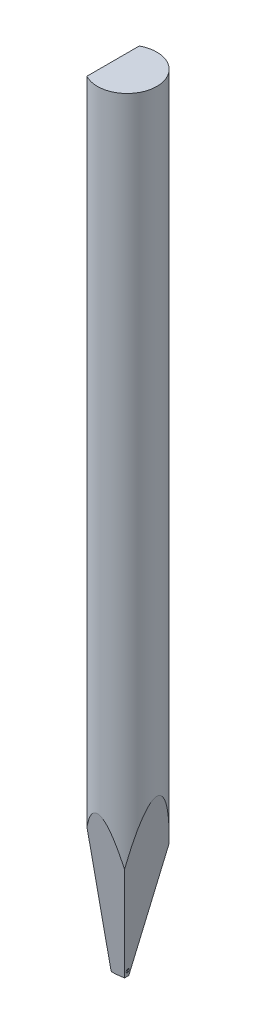
from build123d import *

# Parameters (mm, degrees)
SKETCH_TL_CUTTING_R       = 0.7925
TL_CUTTING_DEPTH          = 21
SKETCH_TDF_GRINDING_W     = 1.625
SKETCH_TDF_GRINDING_H     = 1.625
TDF_GRINDING_DEPTH        = 21
RA_BA_GRINDING_DEPTH      = 0.8125
ISA_GRINDING_DEPTH        = 0.8125
ERW_GRINDING_DEPTH        = 0.0265
H_GRINDING_REACH          = 22.995
FUNNEL_DOWN_HOLE_R        = 0.023
FUNNEL_DOWN_HOLE_3_R      = 0.023
FUNNEL_TOP_HOLE_R         = 1.058533906
BR_EDM_R                  = 0.03
FRO_EDM_R                 = 0.025
RC_CD_GRINDING_DEPTH      = 22.029886174
RC_CD_GRINDING_DEPTH_BACK = 22.029886174
SSKETCH_RC_CD_GRINDING_R  = 0.307
ENGREVING_START           = -0.3755
ENGREVING_OUTLINE_W       = 0.120077237
ENGREVING_OUTLINE_H       = 0.320205966
ENGREVING_DEPTH           = 0.01


# Read off the part's stored shape, not the designer's step: Engreving 
with BuildPart() as part:
    # sketch_TL_cutting → TL_cutting (new body)
    with BuildSketch(Plane(origin=(0, 0, 0), x_dir=(1, 0, 0), z_dir=(0, 1, 0))):
        with Locations(Location((0, 0, 0), (0, 0, 90))):
            Circle(SKETCH_TL_CUTTING_R)
    extrude(amount=TL_CUTTING_DEPTH)

    # sketch_TDF_grinding → TDF_grinding (cut)
    with BuildSketch(Plane(origin=(0, 0, 0), x_dir=(1, 0, 0), z_dir=(0, 1, 0))):
        with Locations((-1.188, 0)):
            Rectangle(SKETCH_TDF_GRINDING_W, SKETCH_TDF_GRINDING_H)
    extrude(amount=TDF_GRINDING_DEPTH, mode=Mode.SUBTRACT)

    # sketch_RA_BA_grinding → RA_BA_grinding (cut, symmetric)
    with BuildSketch(Plane.XY):
        Polygon((-0.2615, 0), (-0.013350574, 0.034875127), (3.683366595, 21), (5.268366595, 21), (5.268366595, -0.02), (-0.2615, -0.02), align=None)
    extrude(amount=RA_BA_GRINDING_DEPTH, both=True, mode=Mode.SUBTRACT)

    # sketch_ISA_grinding → iSA_grinding (cut, symmetric)
    with BuildSketch(Plane(origin=(0, 0, 0), x_dir=(0, 0, -1), z_dir=(1, 0, 0))):
        Polygon((-0.051, 0), (0.051, 0), (3.753866595, 21), (5.338866595, 21), (5.338866595, -0.02), (-5.338866595, -0.02), (-5.338866595, 21), (-3.753866595, 21), align=None)
    extrude(amount=ISA_GRINDING_DEPTH, both=True, mode=Mode.SUBTRACT)


with BuildPart() as body_2:
    # sketch_FLER_grinding → ERW_grinding (new, symmetric)
    with BuildSketch(Plane.XY):
        Polygon((-0.3075, 0), (-0.250983446, 0.075), (-0.1445, 0.075), (-0.1445, 0), align=None)
    extrude(amount=ERW_GRINDING_DEPTH, both=True)

    # Funnel_down_hole → H_grinding (add, up to next)
    with BuildSketch(Plane(origin=(0.056296576, 0.032502843, 0), x_dir=(0, 0, -1), z_dir=(0.8660254037844379, 0.5000000000000013, 0)), mode=Mode.PRIVATE) as h_grinding_sk1:
        with Locations(Location((0, 0.14175, 0), (0, 0, 90))):
            Circle(FUNNEL_DOWN_HOLE_R)
    h_grinding_tool1 = extrude(h_grinding_sk1.sketch, amount=-H_GRINDING_REACH, mode=Mode.PRIVATE) - body_2.part
    add(h_grinding_tool1.solids().sort_by_distance((-0.014578, 0.155262, 0))[0])

    # Funnel_down_hole<3> → Funnel_grinding section 0
    with BuildSketch(Plane(origin=(0.056296576, 0.032502843, 0), x_dir=(0, 0, -1), z_dir=(0.8660254037844379, 0.5000000000000013, 0))):
        with Locations((0, 0.14175)):
            Circle(FUNNEL_DOWN_HOLE_3_R)
    # Funnel_top_hole → Funnel_grinding section 1
    with BuildSketch(Plane(origin=(2.221360085, 1.282502843, 0), x_dir=(0, 0, -1), z_dir=(0.8660254037844379, 0.5000000000000013, 0))):
        with Locations((0, 0.14175)):
            Circle(FUNNEL_TOP_HOLE_R)
    loft()


with BuildPart() as part_1:
    add(part.part)

    # Combine1: cut body 2
    add(body_2.part, mode=Mode.SUBTRACT)

    # BR_EDM
    br_edm_edges = [part_1.edges().sort_by_distance(p)[0] for p in [
        (-0.3075, 0, 0),
    ]]
    fillet(br_edm_edges, radius=BR_EDM_R)

    # FRO_EDM
    fro_edm_edges = [part_1.edges().sort_by_distance(p)[0] for p in [
        (-0.3755, 0, 0),
    ]]
    fillet(fro_edm_edges, radius=FRO_EDM_R)

    # Ssketch_RC_CD_grinding → RC_CD_grinding (cut, two sides: drawn at the far end of the back side and taken through both)
    with BuildSketch(Plane(origin=(0, 0, 0), x_dir=(0, 0, -1), z_dir=(1, 0, 0)).offset(-RC_CD_GRINDING_DEPTH_BACK)):
        with Locations((0, -0.303)):
            Circle(SSKETCH_RC_CD_GRINDING_R)
    extrude(amount=RC_CD_GRINDING_DEPTH + RC_CD_GRINDING_DEPTH_BACK, mode=Mode.SUBTRACT)

    # Engreving outline → Engreving (cut)
    with BuildSketch(Plane(origin=(0, 0, 0), x_dir=(0, 0, -1), z_dir=(1, 0, 0)).offset(ENGREVING_START)):
        with BuildLine():
            add(Edge.make_bspline(
                [(-0.253818211, 17.508861172), (-0.236612893, 17.519349679), (-0.197510219, 17.543186999), (-0.158904169, 17.567821226), (-0.13728492, 17.581616303)],
                knots=[0, 0, 0, 0, 0.44000362, 1, 1, 1, 1], degree=3))
            Line((-0.253818211, 17.508861172), (-0.527327474, 17.342504166))
            Line((-0.527327474, 17.342504166), (-0.527327474, 17.220550722))
            Line((-0.527327474, 17.220550722), (-0.035344349, 17.519909945))
            Line((-0.035344349, 17.519909945), (0.5, 17.193866892))
            Line((0.5, 17.193866892), (0.5, 17.315820336))
            Line((0.5, 17.315820336), (0.127051775, 17.54304983))
            add(Edge.make_bspline(
                [(0.064511548, 17.580782434), (0.073671832, 17.575227963), (0.094490654, 17.562604168), (0.115363169, 17.550069335), (0.127051775, 17.54304983)],
                knots=[0, 0, 0, 0, 0.440000134, 1, 1, 1, 1], degree=3))
            add(Edge.make_bspline(
                [(0.14122756, 17.62727067), (0.129977324, 17.620450082), (0.104408532, 17.604948703), (0.078833563, 17.589457517), (0.064511548, 17.580782434)],
                knots=[0, 0, 0, 0, 0.439998735, 1, 1, 1, 1], degree=3))
            Line((0.14122756, 17.62727067), (0.5, 17.845744532))
            Line((0.5, 17.845744532), (0.5, 17.967697976))
            Line((0.5, 17.967697976), (-0.035761284, 17.641654922))
            Line((-0.035761284, 17.641654922), (-0.527327474, 17.941014145))
            Line((-0.527327474, 17.941014145), (-0.527327474, 17.819060701))
            Line((-0.527327474, 17.819060701), (-0.262156908, 17.657498446))
            add(Edge.make_bspline(
                [(-0.13728492, 17.581616303), (-0.155580249, 17.592777284), (-0.197160576, 17.618143171), (-0.238824882, 17.643370905), (-0.262156908, 17.657498446)],
                knots=[0, 0, 0, 0, 0.439999619, 1, 1, 1, 1], degree=3))
        make_face()
        with BuildLine():
            add(Edge.make_bspline(
                [(-0.253818211, 16.721688172), (-0.236612893, 16.73217668), (-0.197510219, 16.756014), (-0.158904169, 16.780648226), (-0.13728492, 16.794443304)],
                knots=[0, 0, 0, 0, 0.44000362, 1, 1, 1, 1], degree=3))
            Line((-0.253818211, 16.721688172), (-0.527327474, 16.555331167))
            Line((-0.527327474, 16.555331167), (-0.527327474, 16.433377723))
            Line((-0.527327474, 16.433377723), (-0.035344349, 16.732736946))
            Line((-0.035344349, 16.732736946), (0.5, 16.406693892))
            Line((0.5, 16.406693892), (0.5, 16.528647336))
            Line((0.5, 16.528647336), (0.127051775, 16.75587683))
            add(Edge.make_bspline(
                [(0.064511548, 16.793609434), (0.073671832, 16.788054963), (0.094490654, 16.775431169), (0.115363169, 16.762896335), (0.127051775, 16.75587683)],
                knots=[0, 0, 0, 0, 0.440000134, 1, 1, 1, 1], degree=3))
            add(Edge.make_bspline(
                [(0.14122756, 16.84009767), (0.129977324, 16.833277083), (0.104408532, 16.817775704), (0.078833563, 16.802284518), (0.064511548, 16.793609434)],
                knots=[0, 0, 0, 0, 0.439998735, 1, 1, 1, 1], degree=3))
            Line((0.14122756, 16.84009767), (0.5, 17.058571532))
            Line((0.5, 17.058571532), (0.5, 17.180524976))
            Line((0.5, 17.180524976), (-0.035761284, 16.854481922))
            Line((-0.035761284, 16.854481922), (-0.527327474, 17.153841146))
            Line((-0.527327474, 17.153841146), (-0.527327474, 17.031887702))
            Line((-0.527327474, 17.031887702), (-0.262156908, 16.870325447))
            add(Edge.make_bspline(
                [(-0.13728492, 16.794443304), (-0.155580249, 16.805604285), (-0.197160576, 16.830970172), (-0.238824882, 16.856197906), (-0.262156908, 16.870325447)],
                knots=[0, 0, 0, 0, 0.439999619, 1, 1, 1, 1], degree=3))
        make_face()
        with BuildLine():
            add(Edge.make_bspline(
                [(-0.253818211, 15.934515173), (-0.236612893, 15.94500368), (-0.197510219, 15.968841), (-0.158904169, 15.993475227), (-0.13728492, 16.007270304)],
                knots=[0, 0, 0, 0, 0.44000362, 1, 1, 1, 1], degree=3))
            Line((-0.253818211, 15.934515173), (-0.527327474, 15.768158167))
            Line((-0.527327474, 15.768158167), (-0.527327474, 15.646204723))
            Line((-0.527327474, 15.646204723), (-0.035344349, 15.945563946))
            Line((-0.035344349, 15.945563946), (0.5, 15.619520893))
            Line((0.5, 15.619520893), (0.5, 15.741474337))
            Line((0.5, 15.741474337), (0.127051775, 15.968703831))
            add(Edge.make_bspline(
                [(0.064511548, 16.006436435), (0.073671832, 16.000881964), (0.094490654, 15.988258169), (0.115363169, 15.975723336), (0.127051775, 15.968703831)],
                knots=[0, 0, 0, 0, 0.440000134, 1, 1, 1, 1], degree=3))
            add(Edge.make_bspline(
                [(0.14122756, 16.052924671), (0.129977324, 16.046104083), (0.104408532, 16.030602704), (0.078833563, 16.015111518), (0.064511548, 16.006436435)],
                knots=[0, 0, 0, 0, 0.439998735, 1, 1, 1, 1], degree=3))
            Line((0.14122756, 16.052924671), (0.5, 16.271398533))
            Line((0.5, 16.271398533), (0.5, 16.393351977))
            Line((0.5, 16.393351977), (-0.035761284, 16.067308923))
            Line((-0.035761284, 16.067308923), (-0.527327474, 16.366668146))
            Line((-0.527327474, 16.366668146), (-0.527327474, 16.244714702))
            Line((-0.527327474, 16.244714702), (-0.262156908, 16.083152447))
            add(Edge.make_bspline(
                [(-0.13728492, 16.007270304), (-0.155580249, 16.018431285), (-0.197160576, 16.043797172), (-0.238824882, 16.069024906), (-0.262156908, 16.083152447)],
                knots=[0, 0, 0, 0, 0.439999619, 1, 1, 1, 1], degree=3))
        make_face()
        with BuildLine():
            add(Edge.make_bspline(
                [(-0.253818211, 14.079988954), (-0.236612893, 14.090477461), (-0.197510219, 14.114314781), (-0.158904169, 14.138949008), (-0.13728492, 14.152744085)],
                knots=[0, 0, 0, 0, 0.44000362, 1, 1, 1, 1], degree=3))
            Line((-0.253818211, 14.079988954), (-0.527327474, 13.913631948))
            Line((-0.527327474, 13.913631948), (-0.527327474, 13.791678504))
            Line((-0.527327474, 13.791678504), (-0.035344349, 14.091037727))
            Line((-0.035344349, 14.091037727), (0.5, 13.764994673))
            Line((0.5, 13.764994673), (0.5, 13.886948117))
            Line((0.5, 13.886948117), (0.127051775, 14.114177611))
            add(Edge.make_bspline(
                [(0.064511548, 14.151910215), (0.073671832, 14.146355744), (0.094490654, 14.13373195), (0.115363169, 14.121197116), (0.127051775, 14.114177611)],
                knots=[0, 0, 0, 0, 0.440000134, 1, 1, 1, 1], degree=3))
            add(Edge.make_bspline(
                [(0.14122756, 14.198398451), (0.129977324, 14.191577864), (0.104408532, 14.176076485), (0.078833563, 14.160585299), (0.064511548, 14.151910215)],
                knots=[0, 0, 0, 0, 0.439998735, 1, 1, 1, 1], degree=3))
            Line((0.14122756, 14.198398451), (0.5, 14.416872314))
            Line((0.5, 14.416872314), (0.5, 14.538825758))
            Line((0.5, 14.538825758), (-0.035761284, 14.212782704))
            Line((-0.035761284, 14.212782704), (-0.527327474, 14.512141927))
            Line((-0.527327474, 14.512141927), (-0.527327474, 14.390188483))
            Line((-0.527327474, 14.390188483), (-0.262156908, 14.228626228))
            add(Edge.make_bspline(
                [(-0.13728492, 14.152744085), (-0.155580249, 14.163905066), (-0.197160576, 14.189270953), (-0.238824882, 14.214498687), (-0.262156908, 14.228626228)],
                knots=[0, 0, 0, 0, 0.439999619, 1, 1, 1, 1], degree=3))
        make_face()
        with BuildLine():
            add(Edge.make_bspline(
                [(-0.253818211, 13.292815954), (-0.236612893, 13.303304461), (-0.197510219, 13.327141782), (-0.158904169, 13.351776008), (-0.13728492, 13.365571086)],
                knots=[0, 0, 0, 0, 0.44000362, 1, 1, 1, 1], degree=3))
            Line((-0.253818211, 13.292815954), (-0.527327474, 13.126458948))
            Line((-0.527327474, 13.126458948), (-0.527327474, 13.004505504))
            Line((-0.527327474, 13.004505504), (-0.035344349, 13.303864728))
            Line((-0.035344349, 13.303864728), (0.5, 12.977821674))
            Line((0.5, 12.977821674), (0.5, 13.099775118))
            Line((0.5, 13.099775118), (0.127051775, 13.327004612))
            add(Edge.make_bspline(
                [(0.064511548, 13.364737216), (0.073671832, 13.359182745), (0.094490654, 13.346558951), (0.115363169, 13.334024117), (0.127051775, 13.327004612)],
                knots=[0, 0, 0, 0, 0.440000134, 1, 1, 1, 1], degree=3))
            add(Edge.make_bspline(
                [(0.14122756, 13.411225452), (0.129977324, 13.404404865), (0.104408532, 13.388903485), (0.078833563, 13.3734123), (0.064511548, 13.364737216)],
                knots=[0, 0, 0, 0, 0.439998735, 1, 1, 1, 1], degree=3))
            Line((0.14122756, 13.411225452), (0.5, 13.629699314))
            Line((0.5, 13.629699314), (0.5, 13.751652758))
            Line((0.5, 13.751652758), (-0.035761284, 13.425609704))
            Line((-0.035761284, 13.425609704), (-0.527327474, 13.724968928))
            Line((-0.527327474, 13.724968928), (-0.527327474, 13.603015484))
            Line((-0.527327474, 13.603015484), (-0.262156908, 13.441453229))
            add(Edge.make_bspline(
                [(-0.13728492, 13.365571086), (-0.155580249, 13.376732066), (-0.197160576, 13.402097953), (-0.238824882, 13.427325688), (-0.262156908, 13.441453229)],
                knots=[0, 0, 0, 0, 0.439999619, 1, 1, 1, 1], degree=3))
        make_face()
        with BuildLine():
            add(Edge.make_bspline(
                [(-0.253818211, 12.505642955), (-0.236612893, 12.516131462), (-0.197510219, 12.539968782), (-0.158904169, 12.564603008), (-0.13728492, 12.578398086)],
                knots=[0, 0, 0, 0, 0.44000362, 1, 1, 1, 1], degree=3))
            Line((-0.253818211, 12.505642955), (-0.527327474, 12.339285949))
            Line((-0.527327474, 12.339285949), (-0.527327474, 12.217332505))
            Line((-0.527327474, 12.217332505), (-0.035344349, 12.516691728))
            Line((-0.035344349, 12.516691728), (0.5, 12.190648674))
            Line((0.5, 12.190648674), (0.5, 12.312602118))
            Line((0.5, 12.312602118), (0.127051775, 12.539831612))
            add(Edge.make_bspline(
                [(0.064511548, 12.577564216), (0.073671832, 12.572009745), (0.094490654, 12.559385951), (0.115363169, 12.546851117), (0.127051775, 12.539831612)],
                knots=[0, 0, 0, 0, 0.440000134, 1, 1, 1, 1], degree=3))
            add(Edge.make_bspline(
                [(0.14122756, 12.624052452), (0.129977324, 12.617231865), (0.104408532, 12.601730486), (0.078833563, 12.5862393), (0.064511548, 12.577564216)],
                knots=[0, 0, 0, 0, 0.439998735, 1, 1, 1, 1], degree=3))
            Line((0.14122756, 12.624052452), (0.5, 12.842526314))
            Line((0.5, 12.842526314), (0.5, 12.964479759))
            Line((0.5, 12.964479759), (-0.035761284, 12.638436705))
            Line((-0.035761284, 12.638436705), (-0.527327474, 12.937795928))
            Line((-0.527327474, 12.937795928), (-0.527327474, 12.815842484))
            Line((-0.527327474, 12.815842484), (-0.262156908, 12.654280229))
            add(Edge.make_bspline(
                [(-0.13728492, 12.578398086), (-0.155580249, 12.589559067), (-0.197160576, 12.614924954), (-0.238824882, 12.640152688), (-0.262156908, 12.654280229)],
                knots=[0, 0, 0, 0, 0.439999619, 1, 1, 1, 1], degree=3))
        make_face()
        with BuildLine():
            add(Edge.make_bspline(
                [(-0.253818211, 10.984664616), (-0.236612893, 10.995153124), (-0.197510219, 11.018990444), (-0.158904169, 11.04362467), (-0.13728492, 11.057419748)],
                knots=[0, 0, 0, 0, 0.44000362, 1, 1, 1, 1], degree=3))
            Line((-0.253818211, 10.984664616), (-0.527327474, 10.818307611))
            Line((-0.527327474, 10.818307611), (-0.527327474, 10.696354167))
            Line((-0.527327474, 10.696354167), (-0.035344349, 10.99571339))
            Line((-0.035344349, 10.99571339), (0.5, 10.669670336))
            Line((0.5, 10.669670336), (0.5, 10.79162378))
            Line((0.5, 10.79162378), (0.127051775, 11.018853274))
            add(Edge.make_bspline(
                [(0.064511548, 11.056585878), (0.073671832, 11.051031407), (0.094490654, 11.038407613), (0.115363169, 11.025872779), (0.127051775, 11.018853274)],
                knots=[0, 0, 0, 0, 0.440000134, 1, 1, 1, 1], degree=3))
            add(Edge.make_bspline(
                [(0.14122756, 11.103074114), (0.129977324, 11.096253527), (0.104408532, 11.080752148), (0.078833563, 11.065260962), (0.064511548, 11.056585878)],
                knots=[0, 0, 0, 0, 0.439998735, 1, 1, 1, 1], degree=3))
            Line((0.14122756, 11.103074114), (0.5, 11.321547976))
            Line((0.5, 11.321547976), (0.5, 11.44350142))
            Line((0.5, 11.44350142), (-0.035761284, 11.117458367))
            Line((-0.035761284, 11.117458367), (-0.527327474, 11.41681759))
            Line((-0.527327474, 11.41681759), (-0.527327474, 11.294864146))
            Line((-0.527327474, 11.294864146), (-0.262156908, 11.133301891))
            add(Edge.make_bspline(
                [(-0.13728492, 11.057419748), (-0.155580249, 11.068580729), (-0.197160576, 11.093946616), (-0.238824882, 11.11917435), (-0.262156908, 11.133301891)],
                knots=[0, 0, 0, 0, 0.439999619, 1, 1, 1, 1], degree=3))
        make_face()
        with BuildLine():
            add(Edge.make_bspline(
                [(-0.253818211, 10.197491617), (-0.236612893, 10.207980124), (-0.197510219, 10.231817444), (-0.158904169, 10.256451671), (-0.13728492, 10.270246748)],
                knots=[0, 0, 0, 0, 0.44000362, 1, 1, 1, 1], degree=3))
            Line((-0.253818211, 10.197491617), (-0.527327474, 10.031134611))
            Line((-0.527327474, 10.031134611), (-0.527327474, 9.909181167))
            Line((-0.527327474, 9.909181167), (-0.035344349, 10.20854039))
            Line((-0.035344349, 10.20854039), (0.5, 9.882497337))
            Line((0.5, 9.882497337), (0.5, 10.004450781))
            Line((0.5, 10.004450781), (0.127051775, 10.231680275))
            add(Edge.make_bspline(
                [(0.064511548, 10.269412879), (0.073671832, 10.263858408), (0.094490654, 10.251234613), (0.115363169, 10.23869978), (0.127051775, 10.231680275)],
                knots=[0, 0, 0, 0, 0.440000134, 1, 1, 1, 1], degree=3))
            add(Edge.make_bspline(
                [(0.14122756, 10.315901115), (0.129977324, 10.309080527), (0.104408532, 10.293579148), (0.078833563, 10.278087962), (0.064511548, 10.269412879)],
                knots=[0, 0, 0, 0, 0.439998735, 1, 1, 1, 1], degree=3))
            Line((0.14122756, 10.315901115), (0.5, 10.534374977))
            Line((0.5, 10.534374977), (0.5, 10.656328421))
            Line((0.5, 10.656328421), (-0.035761284, 10.330285367))
            Line((-0.035761284, 10.330285367), (-0.527327474, 10.62964459))
            Line((-0.527327474, 10.62964459), (-0.527327474, 10.507691146))
            Line((-0.527327474, 10.507691146), (-0.262156908, 10.346128891))
            add(Edge.make_bspline(
                [(-0.13728492, 10.270246748), (-0.155580249, 10.281407729), (-0.197160576, 10.306773616), (-0.238824882, 10.332001351), (-0.262156908, 10.346128891)],
                knots=[0, 0, 0, 0, 0.439999619, 1, 1, 1, 1], degree=3))
        make_face()
        with BuildLine():
            add(Edge.make_bspline(
                [(-0.253818211, 9.410318617), (-0.236612893, 9.420807125), (-0.197510219, 9.444644445), (-0.158904169, 9.469278671), (-0.13728492, 9.483073749)],
                knots=[0, 0, 0, 0, 0.44000362, 1, 1, 1, 1], degree=3))
            Line((-0.253818211, 9.410318617), (-0.527327474, 9.243961612))
            Line((-0.527327474, 9.243961612), (-0.527327474, 9.122008168))
            Line((-0.527327474, 9.122008168), (-0.035344349, 9.421367391))
            Line((-0.035344349, 9.421367391), (0.5, 9.095324337))
            Line((0.5, 9.095324337), (0.5, 9.217277781))
            Line((0.5, 9.217277781), (0.127051775, 9.444507275))
            add(Edge.make_bspline(
                [(0.064511548, 9.482239879), (0.073671832, 9.476685408), (0.094490654, 9.464061614), (0.115363169, 9.45152678), (0.127051775, 9.444507275)],
                knots=[0, 0, 0, 0, 0.440000134, 1, 1, 1, 1], degree=3))
            add(Edge.make_bspline(
                [(0.14122756, 9.528728115), (0.129977324, 9.521907528), (0.104408532, 9.506406149), (0.078833563, 9.490914963), (0.064511548, 9.482239879)],
                knots=[0, 0, 0, 0, 0.439998735, 1, 1, 1, 1], degree=3))
            Line((0.14122756, 9.528728115), (0.5, 9.747201977))
            Line((0.5, 9.747201977), (0.5, 9.869155421))
            Line((0.5, 9.869155421), (-0.035761284, 9.543112368))
            Line((-0.035761284, 9.543112368), (-0.527327474, 9.842471591))
            Line((-0.527327474, 9.842471591), (-0.527327474, 9.720518147))
            Line((-0.527327474, 9.720518147), (-0.262156908, 9.558955892))
            add(Edge.make_bspline(
                [(-0.13728492, 9.483073749), (-0.155580249, 9.49423473), (-0.197160576, 9.519600617), (-0.238824882, 9.544828351), (-0.262156908, 9.558955892)],
                knots=[0, 0, 0, 0, 0.439999619, 1, 1, 1, 1], degree=3))
        make_face()
        with BuildLine():
            add(Edge.make_bspline(
                [(-0.253818211, 7.889340279), (-0.236612893, 7.899828787), (-0.197510219, 7.923666107), (-0.158904169, 7.948300333), (-0.13728492, 7.962095411)],
                knots=[0, 0, 0, 0, 0.44000362, 1, 1, 1, 1], degree=3))
            Line((-0.253818211, 7.889340279), (-0.527327474, 7.722983274))
            Line((-0.527327474, 7.722983274), (-0.527327474, 7.60102983))
            Line((-0.527327474, 7.60102983), (-0.035344349, 7.900389053))
            Line((-0.035344349, 7.900389053), (0.5, 7.574345999))
            Line((0.5, 7.574345999), (0.5, 7.696299443))
            Line((0.5, 7.696299443), (0.127051775, 7.923528937))
            add(Edge.make_bspline(
                [(0.064511548, 7.961261541), (0.073671832, 7.95570707), (0.094490654, 7.943083276), (0.115363169, 7.930548442), (0.127051775, 7.923528937)],
                knots=[0, 0, 0, 0, 0.440000134, 1, 1, 1, 1], degree=3))
            add(Edge.make_bspline(
                [(0.14122756, 8.007749777), (0.129977324, 8.00092919), (0.104408532, 7.985427811), (0.078833563, 7.969936625), (0.064511548, 7.961261541)],
                knots=[0, 0, 0, 0, 0.439998735, 1, 1, 1, 1], degree=3))
            Line((0.14122756, 8.007749777), (0.5, 8.226223639))
            Line((0.5, 8.226223639), (0.5, 8.348177083))
            Line((0.5, 8.348177083), (-0.035761284, 8.02213403))
            Line((-0.035761284, 8.02213403), (-0.527327474, 8.321493253))
            Line((-0.527327474, 8.321493253), (-0.527327474, 8.199539809))
            Line((-0.527327474, 8.199539809), (-0.262156908, 8.037977554))
            add(Edge.make_bspline(
                [(-0.13728492, 7.962095411), (-0.155580249, 7.973256392), (-0.197160576, 7.998622279), (-0.238824882, 8.023850013), (-0.262156908, 8.037977554)],
                knots=[0, 0, 0, 0, 0.439999619, 1, 1, 1, 1], degree=3))
        make_face()
        with BuildLine():
            add(Edge.make_bspline(
                [(-0.253818211, 7.10216728), (-0.236612893, 7.112655787), (-0.197510219, 7.136493107), (-0.158904169, 7.161127334), (-0.13728492, 7.174922411)],
                knots=[0, 0, 0, 0, 0.44000362, 1, 1, 1, 1], degree=3))
            Line((-0.253818211, 7.10216728), (-0.527327474, 6.935810274))
            Line((-0.527327474, 6.935810274), (-0.527327474, 6.81385683))
            Line((-0.527327474, 6.81385683), (-0.035344349, 7.113216053))
            Line((-0.035344349, 7.113216053), (0.5, 6.787173))
            Line((0.5, 6.787173), (0.5, 6.909126444))
            Line((0.5, 6.909126444), (0.127051775, 7.136355938))
            add(Edge.make_bspline(
                [(0.064511548, 7.174088542), (0.073671832, 7.168534071), (0.094490654, 7.155910276), (0.115363169, 7.143375443), (0.127051775, 7.136355938)],
                knots=[0, 0, 0, 0, 0.440000134, 1, 1, 1, 1], degree=3))
            add(Edge.make_bspline(
                [(0.14122756, 7.220576778), (0.129977324, 7.21375619), (0.104408532, 7.198254811), (0.078833563, 7.182763625), (0.064511548, 7.174088542)],
                knots=[0, 0, 0, 0, 0.439998735, 1, 1, 1, 1], degree=3))
            Line((0.14122756, 7.220576778), (0.5, 7.43905064))
            Line((0.5, 7.43905064), (0.5, 7.561004084))
            Line((0.5, 7.561004084), (-0.035761284, 7.23496103))
            Line((-0.035761284, 7.23496103), (-0.527327474, 7.534320253))
            Line((-0.527327474, 7.534320253), (-0.527327474, 7.412366809))
            Line((-0.527327474, 7.412366809), (-0.262156908, 7.250804554))
            add(Edge.make_bspline(
                [(-0.13728492, 7.174922411), (-0.155580249, 7.186083392), (-0.197160576, 7.211449279), (-0.238824882, 7.236677013), (-0.262156908, 7.250804554)],
                knots=[0, 0, 0, 0, 0.439999619, 1, 1, 1, 1], degree=3))
        make_face()
        with BuildLine():
            add(Edge.make_bspline(
                [(-0.253818211, 6.31499428), (-0.236612893, 6.325482787), (-0.197510219, 6.349320108), (-0.158904169, 6.373954334), (-0.13728492, 6.387749412)],
                knots=[0, 0, 0, 0, 0.44000362, 1, 1, 1, 1], degree=3))
            Line((-0.253818211, 6.31499428), (-0.527327474, 6.148637275))
            Line((-0.527327474, 6.148637275), (-0.527327474, 6.02668383))
            Line((-0.527327474, 6.02668383), (-0.035344349, 6.326043054))
            Line((-0.035344349, 6.326043054), (0.5, 6))
            Line((0.5, 6), (0.5, 6.121953444))
            Line((0.5, 6.121953444), (0.127051775, 6.349182938))
            add(Edge.make_bspline(
                [(0.064511548, 6.386915542), (0.073671832, 6.381361071), (0.094490654, 6.368737277), (0.115363169, 6.356202443), (0.127051775, 6.349182938)],
                knots=[0, 0, 0, 0, 0.440000134, 1, 1, 1, 1], degree=3))
            add(Edge.make_bspline(
                [(0.14122756, 6.433403778), (0.129977324, 6.426583191), (0.104408532, 6.411081811), (0.078833563, 6.395590626), (0.064511548, 6.386915542)],
                knots=[0, 0, 0, 0, 0.439998735, 1, 1, 1, 1], degree=3))
            Line((0.14122756, 6.433403778), (0.5, 6.65187764))
            Line((0.5, 6.65187764), (0.5, 6.773831084))
            Line((0.5, 6.773831084), (-0.035761284, 6.44778803))
            Line((-0.035761284, 6.44778803), (-0.527327474, 6.747147254))
            Line((-0.527327474, 6.747147254), (-0.527327474, 6.62519381))
            Line((-0.527327474, 6.62519381), (-0.262156908, 6.463631555))
            add(Edge.make_bspline(
                [(-0.13728492, 6.387749412), (-0.155580249, 6.398910392), (-0.197160576, 6.424276279), (-0.238824882, 6.449504014), (-0.262156908, 6.463631555)],
                knots=[0, 0, 0, 0, 0.439999619, 1, 1, 1, 1], degree=3))
        make_face()
        with Locations((0.13309733, 15.085844283)):
            Rectangle(ENGREVING_OUTLINE_W, ENGREVING_OUTLINE_H)
        with Locations((0.13309733, 11.990519946)):
            Rectangle(ENGREVING_OUTLINE_W, ENGREVING_OUTLINE_H)
        with Locations((0.13309733, 8.895195608)):
            Rectangle(ENGREVING_OUTLINE_W, ENGREVING_OUTLINE_H)
    extrude(amount=ENGREVING_DEPTH, mode=Mode.SUBTRACT)


solid = part_1.part
